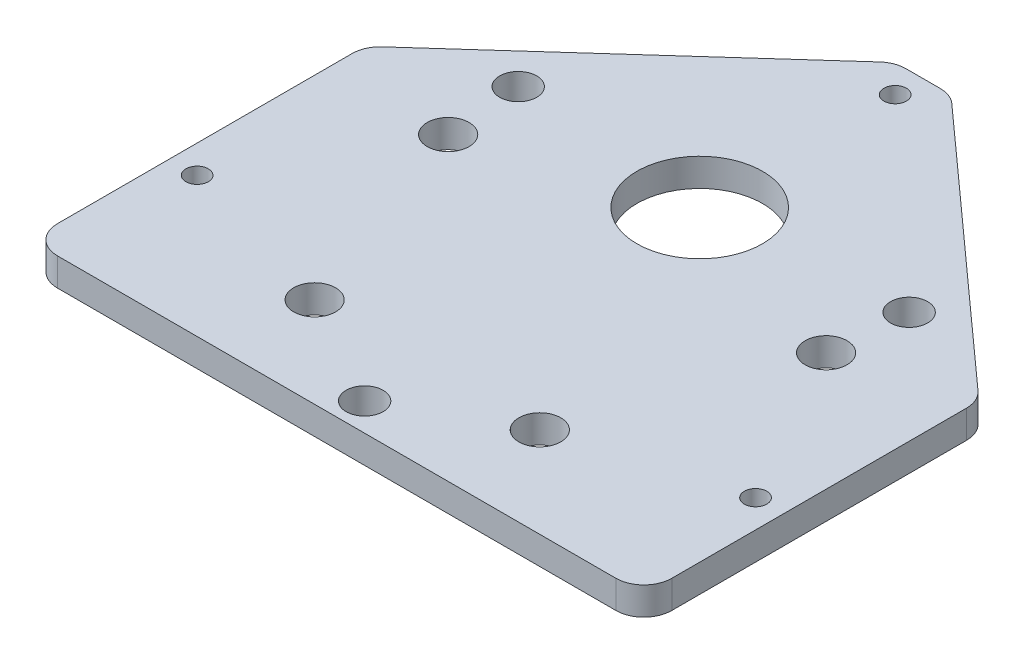
from build123d import *

# Parameters (mm, degrees)
BOSS_EXTRUDE1_DEPTH        = 6.35
SKETCH4_R                  = 14.2875
CUT_EXTRUDE2_DEPTH         = 135.10382172
SKETCH5_R                  = 4.7625
CUT_EXTRUDE3_DEPTH         = 50.8
F_10_CLEARANCE_HOLE1_D     = 5.1054
F_10_CLEARANCE_HOLE1_DEPTH = 50.8
F_10_CLEARANCE_HOLE1_TIP   = 1.533816902
FILLET1_R                  = 6.35
F_5_16_CLEARANCE_HOLE1_D   = 8.4328


with BuildPart() as part:
    # Sketch1 → Boss-Extrude1 (new body)
    with BuildSketch(Plane(origin=(0, 0, 0), x_dir=(1, 0, 0), z_dir=(0, 1, 0))):
        Polygon((-69.85, -19.05), (69.85, -19.05), (69.85, 57.15), (6.35, 114.3), (-6.35, 114.3), (-69.85, 57.15), align=None)
    extrude(amount=BOSS_EXTRUDE1_DEPTH)

    # Sketch4 → Cut-Extrude2 (cut, through all)
    with BuildSketch(Plane(origin=(0, 6.35, 0), x_dir=(1, 0, 0), z_dir=(0, 1, 0))):
        with Locations((0, 63.5)):
            Circle(SKETCH4_R)
    extrude(amount=-CUT_EXTRUDE2_DEPTH, mode=Mode.SUBTRACT)

    # Sketch5 → Cut-Extrude3 (cut)
    with BuildSketch(Plane(origin=(0, 6.35, 19.05), x_dir=(-0.9584281674521108, 0, 0.2853339233851958), z_dir=(0, 1, 0))):
        with Locations((21.697168114, -77.740965053)):
            Circle(SKETCH5_R)
        with Locations((18.665649821, -27.031499499)):
            Circle(SKETCH5_R)
        with Locations((-30.411025551, -12.420868461)):
            Circle(SKETCH5_R)
        with Locations((-60.684163962, -53.21519516)):
            Circle(SKETCH5_R)
    extrude(amount=-CUT_EXTRUDE3_DEPTH, mode=Mode.SUBTRACT)

    # #10 Clearance Hole1
    with Locations(Plane(origin=(0, 6.35, 19.05), x_dir=(1, 0, 0), z_dir=(0, 1, 0))):
        with Locations((-63.5, 31.75), (63.5, 31.75), (0, 127)):
            Hole(F_10_CLEARANCE_HOLE1_D / 2, depth=F_10_CLEARANCE_HOLE1_DEPTH)
            with Locations((0, 0, -(F_10_CLEARANCE_HOLE1_DEPTH + F_10_CLEARANCE_HOLE1_TIP / 2))):  # 118° drill point
                Cone(0, F_10_CLEARANCE_HOLE1_D / 2, F_10_CLEARANCE_HOLE1_TIP, mode=Mode.SUBTRACT)

    # Fillet1
    fillet1_edges = [part.edges().sort_by_distance(p)[0] for p in [
        (-6.35, 3.175, -114.3),
        (6.35, 3.175, -114.3),
        (69.85, 3.175, -57.15),
        (69.85, 3.175, 19.05),
        (-69.85, 3.175, -57.15),
        (-69.85, 3.175, 19.05),
    ]]
    fillet(fillet1_edges, radius=FILLET1_R)

    # 5/16 Clearance Hole1 (through all)
    with Locations(Plane(origin=(0, 0, 19.05), x_dir=(-1, 0, 0), z_dir=(0, -1, 0))):
        with Locations((-44.45, 85.725), (44.45, 85.725), (0, 6.35)):
            Hole(F_5_16_CLEARANCE_HOLE1_D / 2)


solid = part.part
